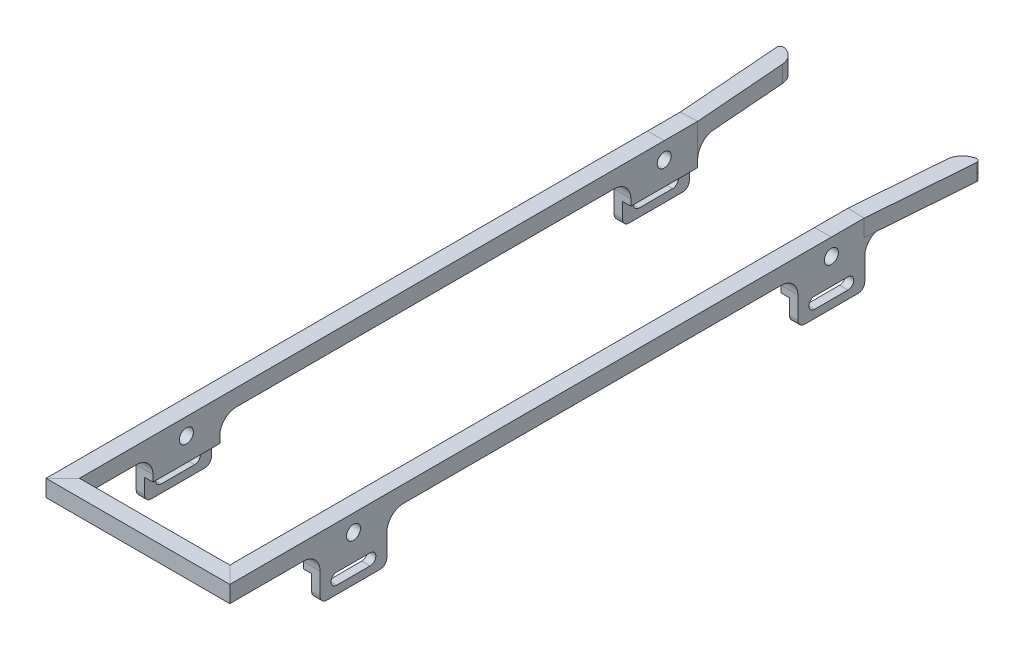
from build123d import *

# Parameters (mm, degrees)
RAIL_PROFILE_W     = 6.35
RAIL_PROFILE_H     = 6.35
BACKCLIP_DEPTH     = 12.7
FRONTCLIP_DEPTH    = 12.7
SKETCH8_R          = 2.667
CUT_EXTRUDE1_DEPTH = 179.88374375
FILLET1_R          = 2.54
CUT_EXTRUDE3_DEPTH = 181.090926708
FILLET3_R          = 6.35
FILLET5_R          = 1.27
FILLET10_R         = 6.35


with BuildPart() as part:
    # Sweep1: sweep along a path in rail_path
    with BuildLine(Plane(origin=(0, 0, 0), x_dir=(1, 0, 0), z_dir=(0, 1, 0))) as sweep1_path:
        Line((31.75, 165.1), (28.575, 123.825))
        Line((28.575, 123.825), (28.575, 111.125))
        Line((28.575, 111.125), (28.575, -111.125))
        Line((28.575, -111.125), (-28.575, -111.125))
        Line((-28.575, -111.125), (-28.575, 111.125))
        Line((-28.575, 111.125), (-28.575, 123.825))
        Line((-28.575, 123.825), (-31.75, 165.1))
    # rail_profile → Sweep1 (sweep)
    with BuildSketch(Plane.XY):
        with Locations((31.75, 3.175)):
            Rectangle(RAIL_PROFILE_W, RAIL_PROFILE_H)
    sweep(path=sweep1_path.line, transition=Transition.RIGHT)

    # BackClipProfile → BackClip (add, symmetric)
    with BuildSketch(Plane(origin=(0, 0, 70.485), x_dir=(-1, 0, 0), z_dir=(0, 0, -1))):
        Polygon((-34.925, -8.89), (-34.925, 0), (-28.575, 0), (-28.575, -8.89), (-31.75, -8.89), (-31.75, -17.272), (-34.925, -17.272), align=None)
    backclip = extrude(amount=BACKCLIP_DEPTH, both=True)

    # BackClipMirror: BackClip across plane
    add(backclip.mirror(Plane(origin=(0, 0, 0), x_dir=(0, 0, 1), z_dir=(1, 0, 0))))

    # FrontClipProfile → FrontClip (add, symmetric)
    with BuildSketch(Plane(origin=(0, 0, -111.125), x_dir=(-1, 0, 0), z_dir=(0, 0, -1))):
        Polygon((-31.75, -17.272), (-31.75, -8.89), (-28.575, -8.89), (-28.575, 0), (-34.925, 0), (-34.925, -8.89), (-34.925, -17.272), align=None)
    frontclip = extrude(amount=FRONTCLIP_DEPTH, both=True)

    # FrontClipMirror: FrontClip across plane
    add(frontclip.mirror(Plane(origin=(0, 0, 0), x_dir=(0, 0, 1), z_dir=(1, 0, 0))))

    # Sketch8 → Cut-Extrude1 (cut, symmetric)
    with BuildSketch(Plane.ZY.offset(-28.575)):
        with Locations((70.485, 0)):
            Circle(SKETCH8_R)
    cut_extrude1 = extrude(amount=CUT_EXTRUDE1_DEPTH, both=True, mode=Mode.SUBTRACT)

    # Fillet1
    fillet1_edges = [part.edges().sort_by_distance(p)[0] for p in [
        (33.3375, -17.272, -98.425),
        (33.3375, -17.272, -123.825),
        (-33.3375, -17.272, -123.825),
        (-33.3375, -17.272, -98.425),
        (33.3375, -17.272, 83.185),
        (33.3375, -17.272, 57.785),
        (-33.3375, -17.272, 57.785),
        (-33.3375, -17.272, 83.185),
    ]]
    fillet(fillet1_edges, radius=FILLET1_R)

    # Mirror2: Cut-Extrude1 across plane
    add(cut_extrude1.mirror(Plane(origin=(0, 0, -20.32), x_dir=(1, 0, 0), z_dir=(0, 0, -1))), mode=Mode.SUBTRACT)

    # Sketch10 → Cut-Extrude3 (cut, symmetric)
    with BuildSketch(Plane.ZY.offset(-31.75)):
        with BuildLine():
            Line((64.135, -9.906), (76.835, -9.906))
            ThreePointArc((76.835, -9.906), (78.994, -12.065), (76.835, -14.224))
            Line((76.835, -14.224), (64.135, -14.224))
            ThreePointArc((64.135, -14.224), (61.976, -12.065), (64.135, -9.906))
        make_face()
    cut_extrude3 = extrude(amount=CUT_EXTRUDE3_DEPTH, both=True, mode=Mode.SUBTRACT)

    # Mirror3: Cut-Extrude3 across plane
    add(cut_extrude3.mirror(Plane(origin=(0, 0, -20.32), x_dir=(1, 0, 0), z_dir=(0, 0, -1))), mode=Mode.SUBTRACT)

    # Fillet3
    fillet3_edges = [part.edges().sort_by_distance(p)[0] for p in [
        (31.75, 3.175, -165.1),
        (-31.75, 3.175, -165.1),
    ]]
    fillet(fillet3_edges, radius=FILLET3_R - 0.0001)  # a hair under: the kernel refuses the full size

    # Fillet5
    fillet5_edges = [part.edges().sort_by_distance(p)[0] for p in [
        (-38.081295983, 3.175, -164.612977232),
        (38.081295983, 3.175, -164.612977232),
    ]]
    fillet(fillet5_edges, radius=FILLET5_R)

    # Fillet10
    fillet10_edges = [part.edges().sort_by_distance(p)[0] for p in [
        (31.75, 0, -98.425),
        (31.75, 0, -123.825),
        (-31.75, 0, -123.825),
        (-31.75, 0, -98.425),
        (31.75, 0, 83.185),
        (31.75, 0, 57.785),
        (-31.75, 0, 57.785),
        (-31.75, 0, 83.185),
    ]]
    fillet(fillet10_edges, radius=FILLET10_R)


solid = part.part
